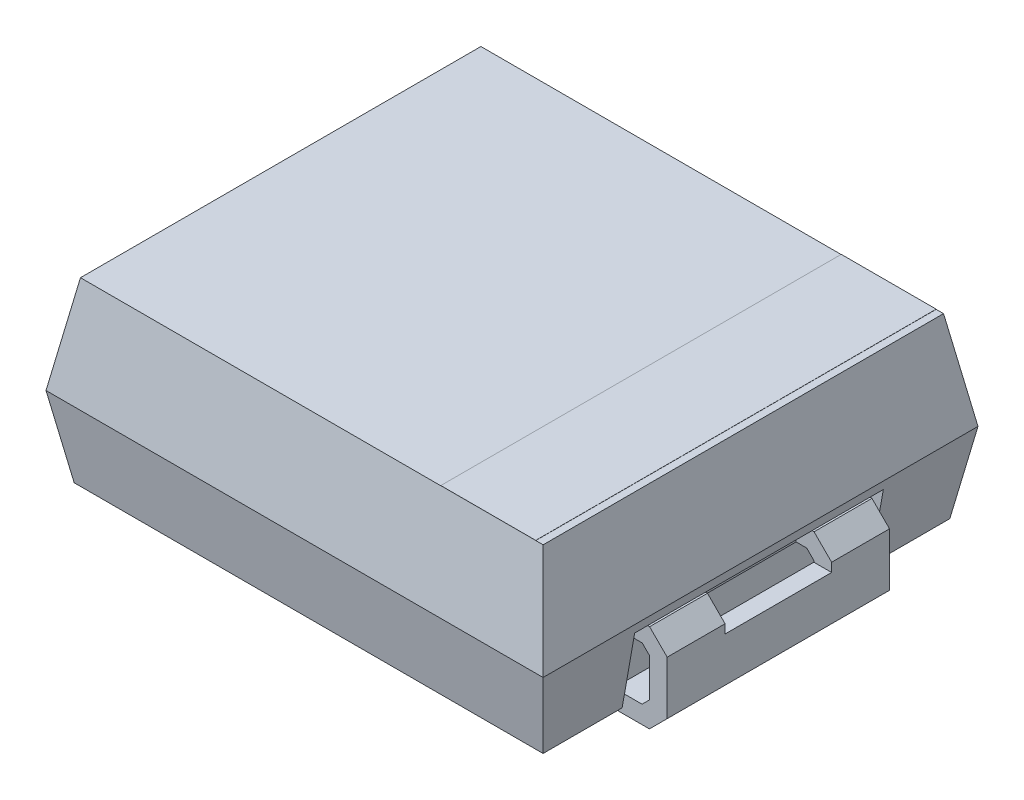
from build123d import *
from OCP.BRepFilletAPI import BRepFilletAPI_MakeChamfer

# Parameters (mm, degrees)
SKETCH2_W                = 6.219952
SKETCH2_H                = 2.794
BASE_EXTRUDE_DEPTH       = 7.10946
CHAMFER1_SIZE            = 1.397
CHAMFER1_SIZE2           = 0.246328792
SKETCH3_W                = 3.556
SKETCH3_H                = 1.27
CUT_EXTRUDE1_DEPTH       = 0.508
SKETCH4_W                = 3.556
SKETCH4_H                = 1.27
CUT_EXTRUDE2_DEPTH       = 0.508
SKETCH5_OUTSIDE_W        = 11.079
SKETCH5_OUTSIDE_H        = 10.19
SKETCH5_OUTSIDE_W_2      = 3.302
SKETCH5_OUTSIDE_H_2      = 3.600196
CUT_EXTRUDE3_DEPTH       = 0.254
CHAMFER2_SIZE            = 1.397
CHAMFER2_SIZE_2          = 0.246328792
BOSS_EXTRUDE_THIN1_DEPTH = 1.589913
SKETCH7_W                = 1.524
SKETCH7_H                = 0.381
CUT_EXTRUDE4_DEPTH       = 0.508
SKETCH8_W                = 1.35763
SKETCH8_H                = 5.727294416
BOSS_EXTRUDE2_DEPTH      = 0.00254


with BuildPart() as part:
    # Sketch2 → Base-Extrude (new body)
    with BuildSketch(Plane(origin=(0, 0, 0), x_dir=(0, 0, -1), z_dir=(1, 0, 0))):
        with Locations((0, 1.397)):
            Rectangle(SKETCH2_W, SKETCH2_H)
    extrude(amount=BASE_EXTRUDE_DEPTH)

    # Chamfer1: one chamfer whose edges measure the first distance from different faces: ONE call of the kernel's chamfer builder (chamfer() names one face for all edges)
    chamfer1_edges_1 = [part.edges().sort_by_distance(p)[0] for p in [
        (7.10946, 0, 0),
    ]]
    chamfer1_side_1 = [part.faces().sort_by_distance(p)[0] for p in [
        (7.10946, 1.397, 0),
    ]]
    chamfer1_edges_2 = [part.edges().sort_by_distance(p)[0] for p in [
        (0, 0, 0),
    ]]
    chamfer1_side_2 = [part.faces().sort_by_distance(p)[0] for p in [
        (0, 1.397, 0),
    ]]
    chamfer1_edges_3 = [part.edges().sort_by_distance(p)[0] for p in [
        (3.55473, 0, -3.109976),
    ]]
    chamfer1_side_3 = [part.faces().sort_by_distance(p)[0] for p in [
        (3.55473, 1.397, -3.109976),
    ]]
    chamfer1_edges_4 = [part.edges().sort_by_distance(p)[0] for p in [
        (3.55473, 0, 3.109976),
    ]]
    chamfer1_side_4 = [part.faces().sort_by_distance(p)[0] for p in [
        (3.55473, 1.397, 3.109976),
    ]]
    chamfer1 = BRepFilletAPI_MakeChamfer(part.part.solid().wrapped)
    for e in chamfer1_edges_1:
        chamfer1.Add(CHAMFER1_SIZE, CHAMFER1_SIZE2, e.wrapped, chamfer1_side_1[0].wrapped)  # the first distance lies on this face
    for e in chamfer1_edges_2:
        chamfer1.Add(CHAMFER1_SIZE, CHAMFER1_SIZE2, e.wrapped, chamfer1_side_2[0].wrapped)  # the first distance lies on this face
    for e in chamfer1_edges_3:
        chamfer1.Add(CHAMFER1_SIZE, CHAMFER1_SIZE2, e.wrapped, chamfer1_side_3[0].wrapped)  # the first distance lies on this face
    for e in chamfer1_edges_4:
        chamfer1.Add(CHAMFER1_SIZE, CHAMFER1_SIZE2, e.wrapped, chamfer1_side_4[0].wrapped)  # the first distance lies on this face
    add(Compound.cast(chamfer1.Shape()), mode=Mode.REPLACE)

    # Sketch3 → Cut-Extrude1 (cut)
    with BuildSketch(Plane.ZY):
        with Locations((0, 0.635)):
            Rectangle(SKETCH3_W, SKETCH3_H)
    extrude(amount=-CUT_EXTRUDE1_DEPTH, mode=Mode.SUBTRACT)

    # Sketch4 → Cut-Extrude2 (cut)
    with BuildSketch(Plane(origin=(7.10946, 0, 0), x_dir=(0, 0, -1), z_dir=(1, 0, 0))):
        with Locations((0, 0.635)):
            Rectangle(SKETCH4_W, SKETCH4_H)
    extrude(amount=-CUT_EXTRUDE2_DEPTH, mode=Mode.SUBTRACT)

    # Sketch5 outside → Cut-Extrude3 (cut)
    with BuildSketch(Plane.XZ):
        with Locations((3.5545, 0)):
            Rectangle(SKETCH5_OUTSIDE_W, SKETCH5_OUTSIDE_H)
        with Locations((3.556, 0)):
            Rectangle(SKETCH5_OUTSIDE_W_2, SKETCH5_OUTSIDE_H_2, mode=Mode.SUBTRACT)
    extrude(amount=-CUT_EXTRUDE3_DEPTH, mode=Mode.SUBTRACT)

    # Chamfer2
    chamfer2_edges_1 = [part.edges().sort_by_distance(p)[0] for p in [
        (0, 2.794, 0),
    ]]
    chamfer2_side_1 = [part.faces().sort_by_distance(p)[0] for p in [
        (0, 2.789073424, 0),
    ]]
    chamfer2_edges_2 = [part.edges().sort_by_distance(p)[0] for p in [
        (7.10946, 2.794, 0),
    ]]
    chamfer2_side_2 = [part.faces().sort_by_distance(p)[0] for p in [
        (7.104533424, 2.794, 0),
    ]]
    chamfer2_edges_3 = [part.edges().sort_by_distance(p)[0] for p in [
        (3.55473, 2.794, 3.109976),
    ]]
    chamfer2_side_3 = [part.faces().sort_by_distance(p)[0] for p in [
        (3.55473, 2.789073424, 3.109976),
    ]]
    chamfer2_edges_4 = [part.edges().sort_by_distance(p)[0] for p in [
        (3.55473, 2.794, -3.109976),
    ]]
    chamfer2_side_4 = [part.faces().sort_by_distance(p)[0] for p in [
        (3.55473, 2.794, -3.105049424),
    ]]
    chamfer2 = BRepFilletAPI_MakeChamfer(part.part.solid().wrapped)
    for e in chamfer2_edges_1:
        chamfer2.Add(CHAMFER2_SIZE - 0.0001, CHAMFER2_SIZE_2 - 0.0001, e.wrapped, chamfer2_side_1[0].wrapped)
    for e in chamfer2_edges_2:
        chamfer2.Add(CHAMFER2_SIZE_2 - 0.0001, CHAMFER2_SIZE - 0.0001, e.wrapped, chamfer2_side_2[0].wrapped)
    for e in chamfer2_edges_3:
        chamfer2.Add(CHAMFER2_SIZE - 0.0001, CHAMFER2_SIZE_2 - 0.0001, e.wrapped, chamfer2_side_3[0].wrapped)
    for e in chamfer2_edges_4:
        chamfer2.Add(CHAMFER2_SIZE_2 - 0.0001, CHAMFER2_SIZE - 0.0001, e.wrapped, chamfer2_side_4[0].wrapped)
    add(Compound.cast(chamfer2.Shape()), mode=Mode.REPLACE)  # a hair under: the kernel refuses the full size

    # Sketch6 → Boss-Extrude-Thin1 (add, symmetric)
    with BuildSketch(Plane.XY):
        Polygon((0.295515086, 1.267447171), (-0.002552829, 1.267447171), (-0.254, 1.016), (-0.254, 0.254), (0, 0), (1.2954, 0), (1.2954, 0.254), (0.105210245, 0.254), (0, 0.359210245), (0, 0.910789755), (0.102657416, 1.013447171), (0.295515086, 1.013447171), align=None)
    boss_extrude_thin1 = extrude(amount=BOSS_EXTRUDE_THIN1_DEPTH, both=True)

    # Sketch7 → Cut-Extrude4 (cut)
    with BuildSketch(Plane.ZY.offset(0.254)):
        with Locations((0, 1.0795)):
            Rectangle(SKETCH7_W, SKETCH7_H)
    cut_extrude4 = extrude(amount=-CUT_EXTRUDE4_DEPTH, mode=Mode.SUBTRACT)

    # Mirror1: Boss-Extrude-Thin1, Cut-Extrude4 across plane
    add(boss_extrude_thin1.mirror(Plane(origin=(3.554984, 0, 0), x_dir=(0, 0, 1), z_dir=(1, 0, 0))))
    add(cut_extrude4.mirror(Plane(origin=(3.554984, 0, 0), x_dir=(0, 0, 1), z_dir=(1, 0, 0))), mode=Mode.SUBTRACT)

    # Sketch8 → Boss-Extrude2 (add)
    with BuildSketch(Plane(origin=(0, 2.794, 0), x_dir=(-1, 0, 0), z_dir=(0, 1, 0))):
        with Locations((-6.078855, 0)):
            Rectangle(SKETCH8_W, SKETCH8_H)
    extrude(amount=BOSS_EXTRUDE2_DEPTH)


solid = part.part
